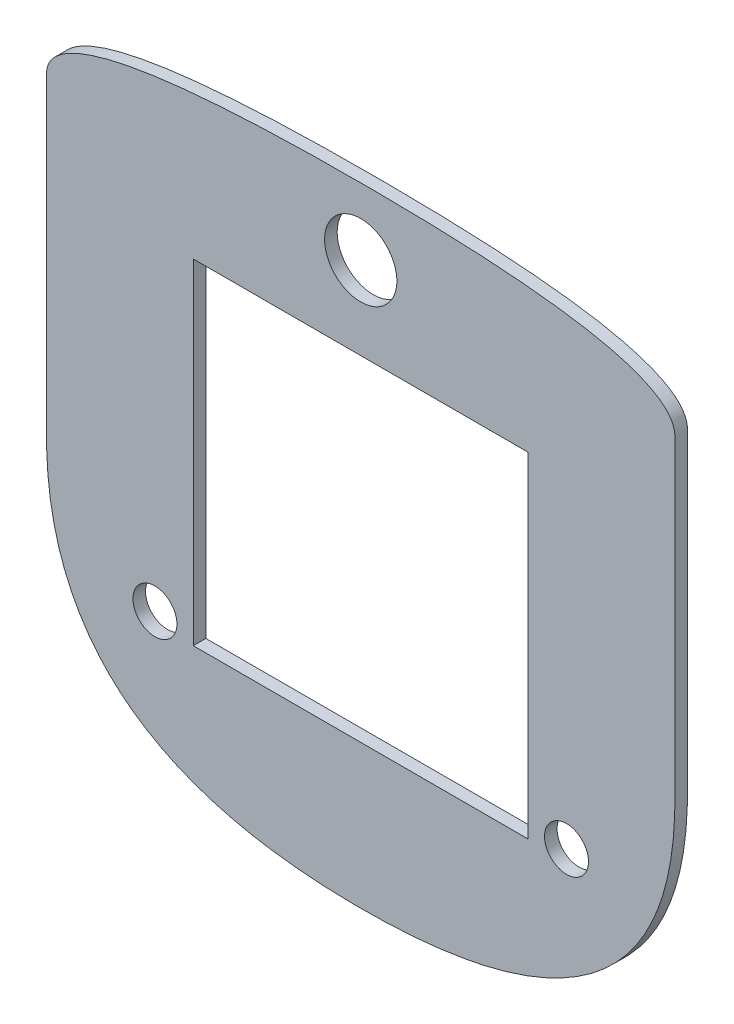
from build123d import *

# Parameters (mm, degrees)
SKETCH1_R           = 7
SKETCH1_R_2         = 11.5
SKETCH1_W           = 106.6
SKETCH1_H           = 106.6
BOSS_EXTRUDE1_DEPTH = 4


with BuildPart() as part:
    # Sketch1 → Boss-Extrude1 (new body)
    with BuildSketch(Plane(origin=(0, 0, 650), x_dir=(-1, 0, 0), z_dir=(0, 0, -1))):
        with BuildLine():
            add(Edge.make_bspline(
                [(-100, 99.999977317), (-100, 100.554133984), (-99.883481571, 101.662960322), (-99.344039294, 103.24640831), (-98.497409778, 104.684675491), (-97.062216748, 106.38426363), (-94.888769283, 108.125797157), (-91.997605564, 109.778159516), (-88.955076104, 111.127119387), (-85.826207347, 112.255213282), (-82.642454957, 113.216882388), (-79.422724525, 114.047932887), (-76.177738988, 114.773887656), (-72.914698058, 115.412911055), (-69.638266917, 115.97899226), (-65.256098304, 116.65012584), (-59.759108699, 117.35435974), (-53.14371303, 118.031992988), (-46.516062932, 118.575061909), (-37.668282191, 119.150076755), (-26.595456571, 119.635916555), (-13.299239269, 119.941405287), (-4.433071045, 120), (4.433071252, 120), (13.299239569, 119.941405284), (26.595457014, 119.635916541), (37.668282553, 119.150076735), (46.516063231, 118.575061887), (53.143713246, 118.031992967), (59.75910884, 117.354359724), (65.256098376, 116.650125829), (69.638266941, 115.978992256), (72.914698049, 115.412911057), (76.177738949, 114.773887664), (79.422724461, 114.047932902), (82.642454874, 113.216882411), (85.826207251, 112.255213314), (88.955076005, 111.127119426), (91.997605468, 109.778159564), (94.888769203, 108.12579721), (97.062216691, 106.384263686), (98.497409744, 104.68467554), (99.344039277, 103.246408352), (99.883481568, 101.662960341), (100, 100.554133999), (100, 91.666668304), (100, 75.00000327), (100, 50.000002643), (100, 25.000000796), (100, 8.333333322), (100, -3.050935369), (99.78232424, -9.153462756), (98.681398999, -18.249623011), (96.67077861, -27.1928131), (93.617740139, -35.841010507), (89.426142861, -44.003661602), (84.079370364, -51.464791939), (77.672911561, -58.036890155), (70.388363316, -63.61609759), (62.44855633, -68.199662094), (51.238518735, -73.075848482), (36.478772164, -77.121799327), (18.308403486, -79.556824296), (6.101870942, -79.999999996), (-6.101870595, -80.000000004), (-18.308402887, -79.556824335), (-36.478771593, -77.121799444), (-51.238518209, -73.07584866), (-62.448555931, -68.1996623), (-70.388363002, -63.6160978), (-77.672911349, -58.036890349), (-84.079370238, -51.464792096), (-89.426142803, -44.003661704), (-93.617740122, -35.841010555), (-96.670778612, -27.192813091), (-98.681399005, -18.249622988), (-99.782324242, -9.153462702), (-100, -3.05093539), (-100, 8.333333413), (-100, 25.000000922), (-100, 50.000002586), (-100, 75.000003054), (-100, 91.666668172), (-100, 99.999977317)],
                knots=[0, 0, 0, 0, 0.002355824, 0.004711648, 0.007067472, 0.009423297, 0.014134945, 0.018846593, 0.023558241, 0.02826989, 0.032981538, 0.037693186, 0.042404834, 0.047116483, 0.051828131, 0.056539779, 0.065963076, 0.075386372, 0.084809669, 0.094232965, 0.113079558, 0.131926151, 0.150772744, 0.150772744, 0.169619384, 0.188466024, 0.207312664, 0.216735984, 0.226159304, 0.235582624, 0.245005944, 0.249717604, 0.254429264, 0.259140924, 0.263852584, 0.268564244, 0.273275904, 0.277987564, 0.282699224, 0.287410884, 0.292122544, 0.294478375, 0.296834205, 0.299190035, 0.301545865, 0.301545865, 0.336972328, 0.372398791, 0.407825254, 0.443251717, 0.443251717, 0.456221785, 0.469191854, 0.482161922, 0.49513199, 0.508102059, 0.521072127, 0.534042195, 0.547012264, 0.559982332, 0.5729524, 0.598892537, 0.624832673, 0.65077281, 0.65077281, 0.676712977, 0.702653144, 0.728593312, 0.741563395, 0.754533479, 0.767503562, 0.780473646, 0.79344373, 0.806413813, 0.819383897, 0.83235398, 0.845324064, 0.858294148, 0.858294148, 0.893720611, 0.929147074, 0.964573537, 1, 1, 1, 1], degree=3))
        make_face()
        with Locations((-65.5, -30.887752409)):
            Circle(SKETCH1_R, mode=Mode.SUBTRACT)
        with Locations((65.5, -30.887752409)):
            Circle(SKETCH1_R, mode=Mode.SUBTRACT)
        with Locations((0, 98.65018449)):
            Circle(SKETCH1_R_2, mode=Mode.SUBTRACT)
        with Locations((0, 19.05)):
            Rectangle(SKETCH1_W, SKETCH1_H, mode=Mode.SUBTRACT)
    extrude(amount=-BOSS_EXTRUDE1_DEPTH)


solid = part.part
